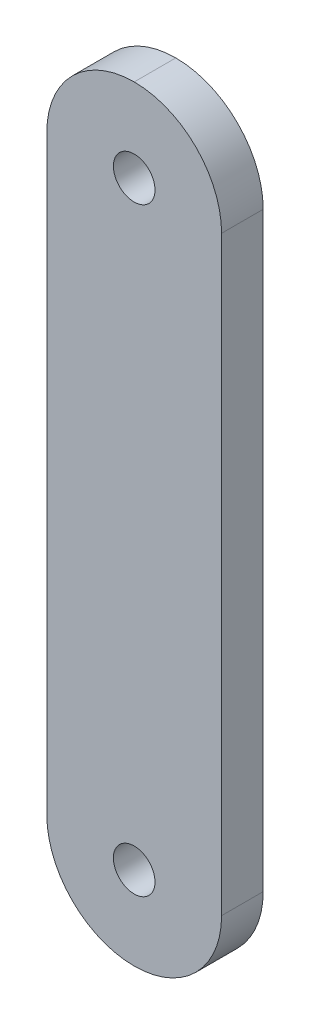
from build123d import *

# Parameters (mm, degrees)
SKETCH_1_W          = 21
SKETCH_1_H          = 92
EXTRUDE_1_DEPTH     = 5
SKETCH_3_R          = 2.5
CUT_EXTRUDE_1_DEPTH = 15
SKETCH_4_R          = 2.5
CUT_EXTRUDE_2_DEPTH = 15
FILLET_2_R          = 10.5


with BuildPart() as part:
    # 草图1 → 凸台-拉伸1 (new body)
    with BuildSketch(Plane.XY):
        with Locations((-49.157142857, -8.885714286)):
            Rectangle(SKETCH_1_W, SKETCH_1_H)
    extrude(amount=EXTRUDE_1_DEPTH)

    # 草图3 → 切除-拉伸1 (cut)
    with BuildSketch(Plane.XY.offset(5)):
        with Locations((-49.157142857, -44.885714286)):
            Circle(SKETCH_3_R)
    extrude(amount=-CUT_EXTRUDE_1_DEPTH, mode=Mode.SUBTRACT)

    # 草图4 → 切除-拉伸2 (cut)
    with BuildSketch(Plane.XY.offset(5)):
        with Locations((-49.157142857, 27.114285714)):
            Circle(SKETCH_4_R)
    extrude(amount=-CUT_EXTRUDE_2_DEPTH, mode=Mode.SUBTRACT)

    # 圆角2
    fillet_2_edges = [part.edges().sort_by_distance(p)[0] for p in [
        (-38.657142857, 37.114285714, 2.5),
        (-59.657142857, 37.114285714, 2.5),
        (-38.657142857, -54.885714286, 2.5),
        (-59.657142857, -54.885714286, 2.5),
    ]]
    fillet(fillet_2_edges, radius=FILLET_2_R - 0.0001)  # a hair under: the kernel refuses the full size


solid = part.part
